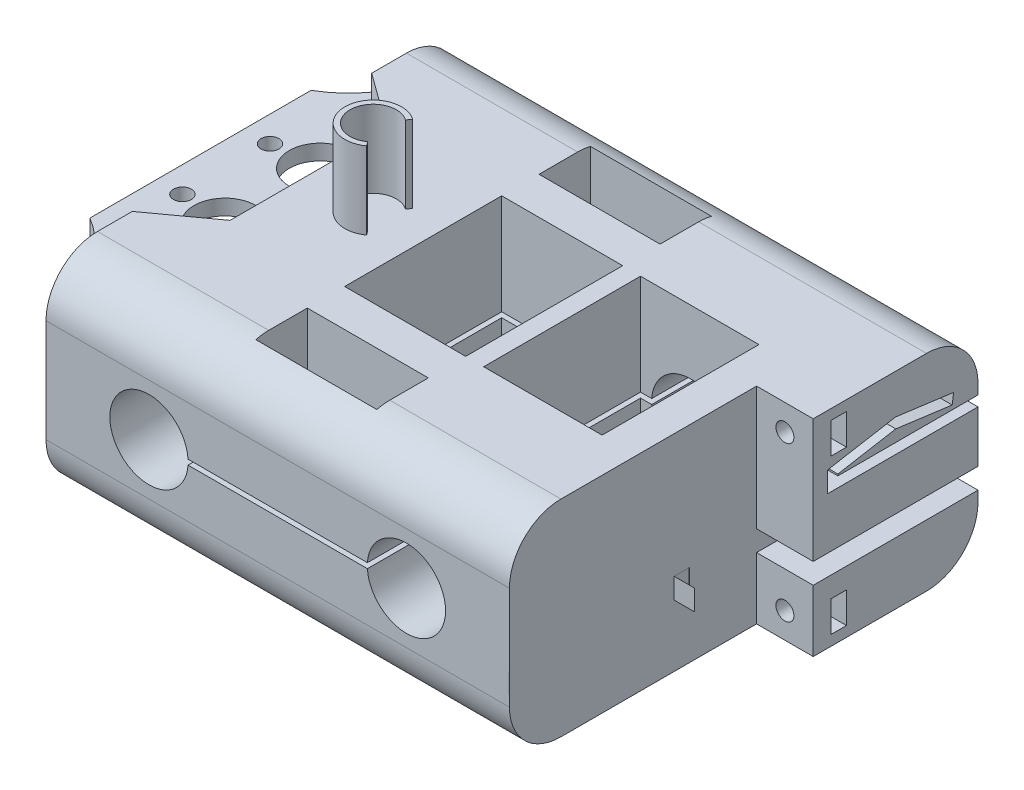
from build123d import *

# Parameters (mm, degrees)
SKETCH1_W                    = 90
SKETCH1_H                    = 40
SKETCH1_R                    = 7.6
BOSS_EXTRUDE1_DEPTH          = 80
SKETCH2_W                    = 30.5
SKETCH2_H                    = 40
CUT_EXTRUDE1_DEPTH           = 10
SKETCH3_W                    = 23.5
SKETCH3_H                    = 30.5
SKETCH3_H_2                  = 10
CUT_EXTRUDE2_DEPTH           = 46
CHAMFER1_SIZE                = 10
SKETCH4_W                    = 30.5
SKETCH4_H                    = 3
BOSS_EXTRUDE2_DEPTH          = 20
SKETCH5_R                    = 1.75
CUT_EXTRUDE3_DEPTH           = 20
SKETCH6_R                    = 6
CUT_EXTRUDE4_DEPTH           = 20
SKETCH8_W                    = 30.5
SKETCH8_H                    = 7
CUT_EXTRUDE5_DEPTH           = 1
CHAMFER3_SIZE                = 8
CHAMFER3_SIZE_2              = 11
CHAMFER4_SIZE                = 8
CHAMFER4_SIZE_2              = 45.370254557
SKETCH9_R                    = 1.75
CUT_EXTRUDE6_DEPTH           = 33
CUT_EXTRUDE7_DEPTH           = 13.25
EXTRUDE_THIN1_DEPTH          = 15
FILLET1_R                    = 10
CUT_EXTRUDE_THIN1_DEPTH      = 112.915146428
CUT_EXTRUDE_THIN1_DEPTH_BACK = 95
FILLET2_START                = 10
FILLET2_DEPTH                = 3
BOSS_EXTRUDE3_DEPTH          = 11
CUT_EXTRUDE_THIN2_START      = -6
CUT_EXTRUDE_THIN2_DEPTH      = 148.230308362
CUT_EXTRUDE_THIN3_START      = -11
SKETCH15_W                   = 32
SKETCH15_H                   = 4
CUT_EXTRUDE_THIN3_DEPTH      = 153.230308362
SKETCH16_R                   = 1.75
CUT_EXTRUDE8_DEPTH           = 15.99669
SKETCH17_W                   = 3
SKETCH17_H                   = 6
CUT_EXTRUDE9_DEPTH           = 11
SKETCH18_W                   = 23
SKETCH18_H                   = 30.465957047
CUT_EXTRUDE10_DEPTH          = 72
SKETCH19_R                   = 3
CUT_EXTRUDE11_DEPTH          = 22
SKETCH25_W                   = 11.010141894
SKETCH25_H                   = 4
CUT_EXTRUDE13_DEPTH          = 3
SKETCH26_W                   = 32.00591654
SKETCH26_H                   = 4
BOSS_EXTRUDE4_DEPTH          = 4
SURFACE_EXTRUDE2_1_BACK      = 61
SURFACE_EXTRUDE2_1_DEPTH     = 61


with BuildPart() as part:
    # Sketch1 → Boss-Extrude1 (new body)
    with BuildSketch(Plane.XY):
        with Locations((25, 0)):
            Rectangle(SKETCH1_W, SKETCH1_H)
        Circle(SKETCH1_R, mode=Mode.SUBTRACT)
        with Locations((50, 0)):
            Circle(SKETCH1_R, mode=Mode.SUBTRACT)
    extrude(amount=BOSS_EXTRUDE1_DEPTH)

    # Sketch2 → Cut-Extrude1 (cut)
    with BuildSketch(Plane.ZY.offset(20)):
        with Locations((40, 0)):
            Rectangle(SKETCH2_W, SKETCH2_H)
    extrude(amount=-CUT_EXTRUDE1_DEPTH, mode=Mode.SUBTRACT)

    # Sketch3 → Cut-Extrude2 (cut)
    with BuildSketch(Plane(origin=(0, 20, 0), x_dir=(1, 0, 0), z_dir=(0, 1, 0))):
        with Locations((25, -40)):
            Rectangle(SKETCH3_W, SKETCH3_H)
        with Locations((25, -12.5)):
            Rectangle(SKETCH3_W, SKETCH3_H_2)
        with Locations((25, -67.5)):
            Rectangle(SKETCH3_W, SKETCH3_H_2)
    extrude(amount=-CUT_EXTRUDE2_DEPTH, mode=Mode.SUBTRACT)

    # Chamfer1
    chamfer1_edges = [part.edges().sort_by_distance(p)[0] for p in [
        (13.25, -20, 67.5),
        (13.25, -20, 12.5),
    ]]
    chamfer(chamfer1_edges, length=CHAMFER1_SIZE)

    # Sketch4 → Boss-Extrude2 (add)
    with BuildSketch(Plane.ZY.offset(10)):
        with Locations((40, 11.5)):
            Rectangle(SKETCH4_W, SKETCH4_H)
    extrude(amount=BOSS_EXTRUDE2_DEPTH)

    # Sketch5 → Cut-Extrude3 (cut)
    with BuildSketch(Plane(origin=(0, 13, 0), x_dir=(1, 0, 0), z_dir=(0, 1, 0))):
        with Locations(Location((-25, -31.5, 0), (0, 0, 180))):
            Circle(SKETCH5_R)
        with Locations(Location((-25, -48.5, 0), (0, 0, 180))):
            Circle(SKETCH5_R)
    extrude(amount=-CUT_EXTRUDE3_DEPTH, mode=Mode.SUBTRACT)

    # Sketch6 → Cut-Extrude4 (cut)
    with BuildSketch(Plane(origin=(0, 13, 0), x_dir=(1, 0, 0), z_dir=(0, 1, 0))):
        with Locations(Location((-16, -30.75, 0), (0, 0, 90))):
            Circle(SKETCH6_R)
        with Locations(Location((-16, -49.25, 0), (0, 0, 270))):
            Circle(SKETCH6_R)
    extrude(amount=-CUT_EXTRUDE4_DEPTH, mode=Mode.SUBTRACT)

    # Sketch8 → Cut-Extrude5 (cut)
    with BuildSketch(Plane.ZY.offset(10)):
        with Locations((40, 16.5)):
            Rectangle(SKETCH8_W, SKETCH8_H)
    extrude(amount=-CUT_EXTRUDE5_DEPTH, mode=Mode.SUBTRACT)

    # Chamfer3
    # the kernel refuses this chamfer: 11, 8 mm, written as the material it takes off along each edge
    with BuildSketch(Plane(origin=(-20, 48.396981056, 55.25), x_dir=(0, 0, 1), z_dir=(0, -1, 0))) as chamfer3_piece_1:
        Polygon((CHAMFER3_SIZE, 0), (0, -CHAMFER3_SIZE_2), (0, 0), align=None)
    extrude(amount=35.396981056, mode=Mode.SUBTRACT)
    with BuildSketch(Plane(origin=(-20, 13, 24.75), x_dir=(1, 0, 0), z_dir=(0, 1, 0))) as chamfer3_piece_2:
        Polygon((CHAMFER3_SIZE_2, 0), (0, CHAMFER3_SIZE), (0, 0), align=None)
    extrude(amount=35.396981056, mode=Mode.SUBTRACT)

    # Chamfer4
    # the kernel refuses this chamfer: 45.370254557, 8 mm, written as the material it adds along each edge
    with BuildSketch(Plane(origin=(-20, 13, 55.25), x_dir=(0, 0, 1), z_dir=(0, -1, 0))) as chamfer4_piece_1_section:
        Polygon((CHAMFER4_SIZE, 0), (0, CHAMFER4_SIZE_2), (0, 0), align=None)
    chamfer4_piece_1 = extrude(amount=3, mode=Mode.PRIVATE)
    chamfer4_piece_1 = split(chamfer4_piece_1, bisect_by=Plane(origin=(-30, 13, 55.25), z_dir=(1, 0, 0)), keep=Keep.TOP, mode=Mode.PRIVATE)
    add(chamfer4_piece_1)
    # the kernel refuses this chamfer: 45.370254557, 8 mm, written as the material it adds along each edge
    with BuildSketch(Plane(origin=(-20, 10, 24.75), x_dir=(0, 0, -1), z_dir=(0, 1, 0))) as chamfer4_2_piece_1_section:
        Polygon((CHAMFER4_SIZE, 0), (0, CHAMFER4_SIZE_2), (0, 0), align=None)
    chamfer4_2_piece_1 = extrude(amount=3, mode=Mode.PRIVATE)
    chamfer4_2_piece_1 = split(chamfer4_2_piece_1, bisect_by=Plane(origin=(-30, 10, 24.75), z_dir=(1, 0, 0)), keep=Keep.TOP, mode=Mode.PRIVATE)
    add(chamfer4_2_piece_1)

    # Sketch9 → Cut-Extrude6 (cut)
    with BuildSketch(Plane.ZY.offset(10)):
        with Locations(Location((40, -10, 0), (0, 0, 270))):
            Circle(SKETCH9_R)
    extrude(amount=-CUT_EXTRUDE6_DEPTH, mode=Mode.SUBTRACT)

    # Sketch10 → Cut-Extrude7 (cut)
    with BuildSketch(Plane(origin=(13.25, 0, 0), x_dir=(0, 0, -1), z_dir=(1, 0, 0))):
        Polygon((-40, -13.464101615), (-37, -11.732050808), (-37, -8.267949192), (-40, -6.535898385), (-43, -8.267949192), (-43, -11.732050808), align=None)
    extrude(amount=-CUT_EXTRUDE7_DEPTH, mode=Mode.SUBTRACT)

    # Sketch11 → Extrude-Thin1 (add)
    with BuildSketch(Plane(origin=(0, 20, 0), x_dir=(1, 0, 0), z_dir=(0, 1, 0))):
        with BuildLine():
            ThreePointArc((6.729729503, -35.51864706), (-1.958918458, -40), (6.729729503, -44.48135294))
            Line((6.729729503, -44.48135294), (6.149975329, -43.666561497))
            ThreePointArc((6.149975329, -43.666561497), (-0.958918458, -40), (6.149975329, -36.333438503))
            Line((6.149975329, -36.333438503), (6.729729503, -35.51864706))
        make_face()
    extrude(amount=EXTRUDE_THIN1_DEPTH)

    # Fillet1
    # the kernel refuses this fillet: 10 mm, written as the material it takes off along each edge
    with BuildSketch(Plane(origin=(-45, 20, 80), x_dir=(0, 0, -1), z_dir=(1, 0, 0)), Plane(origin=(95, -20, 80), x_dir=(0, 0, -1), z_dir=(-1, 0, 0)), Plane(origin=(95, -20, 0), x_dir=(0, 1, 0), z_dir=(-1, 0, 0)), Plane(origin=(-45, 20, 0), x_dir=(0, -1, 0), z_dir=(1, 0, 0))) as fillet1_piece_1:
        with BuildLine():
            CenterArc((FILLET1_R, -FILLET1_R), FILLET1_R, 90, 90)
            Line((0, -FILLET1_R), (0, 0))
            Line((0, 0), (FILLET1_R, 0))
        make_face()
    extrude(amount=140, mode=Mode.SUBTRACT)

    # Sketch12 → Cut-Extrude-Thin1 (cut, two sides: drawn at the far end of the back side and taken through both)
    with BuildSketch(Plane.XY.offset(80).offset(-CUT_EXTRUDE_THIN1_DEPTH_BACK)):
        Polygon((3.119310539, -0.5), (7.6, -0.5), (42.4, -0.5), (46.98201893, -0.5), (46.98201893, 0.5), (42.4, 0.5), (7.6, 0.5), (3.119310539, 0.5), align=None)
    extrude(amount=CUT_EXTRUDE_THIN1_DEPTH + CUT_EXTRUDE_THIN1_DEPTH_BACK, mode=Mode.SUBTRACT)

    # Fillet2: read off the stored shape, not the designer's step
    # Fillet2 outline → Fillet2 (add)
    with BuildSketch(Plane(origin=(0, 0, 0), x_dir=(1, 0, 0), z_dir=(0, 1, 0)).offset(FILLET2_START)):
        with BuildLine():
            ThreePointArc((-30, -61.486730193), (-22.679491924, -68.807238269), (-20, -78.807238269))
            Line((-20, -78.807238269), (-20, -63.25))
            Line((-20, -63.25), (-30, -61.486730193))
        make_face()
        with BuildLine():
            Line((-20, -16.75), (-20, -1.192761731))
            ThreePointArc((-20, -1.192761731), (-22.679491924, -11.192761731), (-30, -18.513269807))
            Line((-30, -18.513269807), (-20, -16.75))
        make_face()
    extrude(amount=FILLET2_DEPTH)

    # Sketch13 → Boss-Extrude3 (add)
    with BuildSketch(Plane(origin=(70, 0, 0), x_dir=(0, 0, -1), z_dir=(1, 0, 0))):
        with BuildLine():
            Line((-10, 20), (-32, 20))
            Line((-32, 20), (-32, -20))
            Line((-32, -20), (-10, -20))
            ThreePointArc((-10, -20), (-2.928932188, -17.071067812), (0, -10))
            Line((0, -10), (0, 10))
            ThreePointArc((0, 10), (-2.928932188, 17.071067812), (-10, 20))
        make_face()
        with BuildLine():
            Line((-48, -20), (-48, 20))
            Line((-48, 20), (-70, 20))
            ThreePointArc((-70, 20), (-77.071067812, 17.071067812), (-80, 10))
            Line((-80, 10), (-80, -10))
            ThreePointArc((-80, -10), (-77.071067812, -17.071067812), (-70, -20))
            Line((-70, -20), (-48, -20))
        make_face()
    extrude(amount=BOSS_EXTRUDE3_DEPTH)

    # Sketch14 → Cut-Extrude-Thin2 (cut)
    with BuildSketch(Plane(origin=(81, 0, 0), x_dir=(0, 0, -1), z_dir=(1, 0, 0)).offset(CUT_EXTRUDE_THIN2_START)):
        Polygon((0, 6), (-29.211170014, 6), (-29.211170014, 10), (-16.003311772, 12.306433224), (-4.745103337, 10.807010671), (-5.009141506, 8.824516321), (-15.962361409, 10.283319029), (-27.211170014, 8.318986477), (-27.211170014, 8), (0, 8), align=None)
    cut_extrude_thin2 = extrude(amount=CUT_EXTRUDE_THIN2_DEPTH, mode=Mode.SUBTRACT)

    # Sketch15 → Cut-Extrude-Thin3 (cut)
    with BuildSketch(Plane(origin=(81, 0, 0), x_dir=(0, 0, -1), z_dir=(1, 0, 0)).offset(CUT_EXTRUDE_THIN3_START)):
        with Locations((-16, -6)):
            Rectangle(SKETCH15_W, SKETCH15_H)
    cut_extrude_thin3 = extrude(amount=CUT_EXTRUDE_THIN3_DEPTH, mode=Mode.SUBTRACT)

    # Sketch16 → Cut-Extrude8 (cut)
    with BuildSketch(Plane.XY.offset(32)):
        with Locations((75.5, 15)):
            Circle(SKETCH16_R)
        with Locations((75.5, -15)):
            Circle(SKETCH16_R)
    cut_extrude8 = extrude(amount=-CUT_EXTRUDE8_DEPTH, mode=Mode.SUBTRACT)

    # Sketch17 → Cut-Extrude9 (cut)
    with BuildSketch(Plane(origin=(81, 0, 0), x_dir=(0, 0, -1), z_dir=(1, 0, 0))):
        with Locations((-27.043626223, 15)):
            Rectangle(SKETCH17_W, SKETCH17_H)
    cut_extrude9 = extrude(amount=-CUT_EXTRUDE9_DEPTH, mode=Mode.SUBTRACT)

    # Mirror1: Cut-Extrude9 across plane
    add(cut_extrude9.mirror(Plane.ZX), mode=Mode.SUBTRACT)

    # Sketch18 → Cut-Extrude10 (cut)
    with BuildSketch(Plane(origin=(0, 20, 0), x_dir=(1, 0, 0), z_dir=(0, 1, 0))):
        with Locations((51.74672632, -40.017021476)):
            Rectangle(SKETCH18_W, SKETCH18_H)
    extrude(amount=-CUT_EXTRUDE10_DEPTH, mode=Mode.SUBTRACT)

    # Mirror4: Cut-Extrude-Thin2, Cut-Extrude-Thin3 across plane
    add(cut_extrude_thin2.mirror(Plane(origin=(-0.025214783, 0, 39.991629957), x_dir=(0.9999998012339909, 0, 0.0006305013708499051), z_dir=(0.0006305013708499051, 0, -0.999999801233991))), mode=Mode.SUBTRACT)
    add(cut_extrude_thin3.mirror(Plane(origin=(-0.025214783, 0, 39.991629957), x_dir=(0.9999998012339909, 0, 0.0006305013708499051), z_dir=(0.0006305013708499051, 0, -0.999999801233991))), mode=Mode.SUBTRACT)

    # Mirror5: Cut-Extrude8 across plane
    add(cut_extrude8.mirror(Plane(origin=(-0.025214783, 0, 39.991629957), x_dir=(0.9999998012339909, 0, 0.0006305013708499051), z_dir=(0.0006305013708499051, 0, -0.999999801233991))), mode=Mode.SUBTRACT)

    # Sketch19 → Cut-Extrude11 (cut)
    with BuildSketch(Plane.XY.offset(80)):
        with Locations((75.5, 15)):
            Circle(SKETCH19_R)
        with Locations((75.5, -15)):
            Circle(SKETCH19_R)
    extrude(amount=-CUT_EXTRUDE11_DEPTH, mode=Mode.SUBTRACT)

    # Sketch25 → Cut-Extrude13 (cut)
    with BuildSketch(Plane(origin=(-0.06050701, 0, 47.983221765), x_dir=(0.9999992049360428, 0, 0.0012610024910553283), z_dir=(-0.0012610024910553281, 0, 0.9999992049360427))):
        with Locations((75.555500512, -6)):
            Rectangle(SKETCH25_W, SKETCH25_H)
    extrude(amount=-CUT_EXTRUDE13_DEPTH, mode=Mode.SUBTRACT)

    # Sketch26 → Boss-Extrude4 (add)
    with BuildSketch(Plane(origin=(70.05037387, 0, 0.088333766), x_dir=(0.0012610024910553283, 0, -0.9999992049360428), z_dir=(0.9999992049360427, 0, 0.0012610024910553281))):
        with Locations((-63.908771499, -6)):
            Rectangle(SKETCH26_W, SKETCH26_H)
    extrude(amount=BOSS_EXTRUDE4_DEPTH)

    # Split2: cut with a surface, the side behind it stays
    # Surface-Extrude2: a surface, the sketch's curves swept straight by 61 mm
    with BuildLine(Plane(origin=(0, 20, 0), x_dir=(1, 0, 0), z_dir=(0, 1, 0)).offset(-SURFACE_EXTRUDE2_1_BACK), mode=Mode.PRIVATE) as surface_extrude2_1_path:
        Line((81, -48), (70, -48))
        Line((70, -48), (70, -104.300780198))
    surface_extrude2_1 = Shell.extrude(surface_extrude2_1_path.wire(), (0 * SURFACE_EXTRUDE2_1_DEPTH, 1 * SURFACE_EXTRUDE2_1_DEPTH, 0 * SURFACE_EXTRUDE2_1_DEPTH))
    split(bisect_by=surface_extrude2_1, keep=Keep.BOTTOM)


solid = part.part
